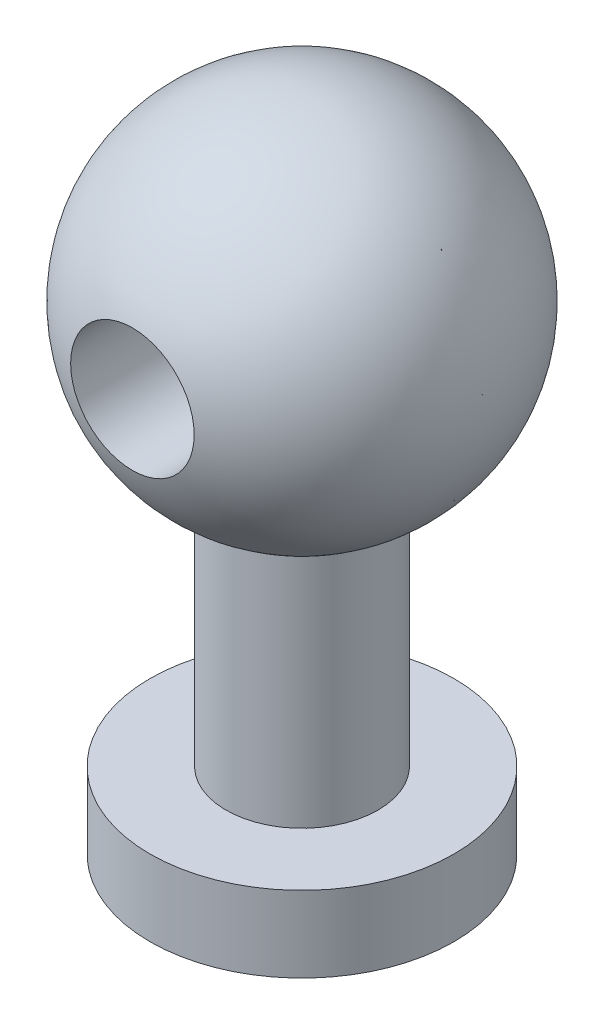
from build123d import *

# Parameters (mm, degrees)
REVOLVE1_ANGLE     = 359.999695921
SKETCH2_R          = 3.25
CUT_EXTRUDE1_DEPTH = 20


with BuildPart() as part:
    # Sketch1 → Revolve1 (revolve)
    with BuildSketch(Plane.XY):
        with BuildLine():
            Line((0, 0), (8, 0))
            Line((8, 0), (8, 4))
            Line((8, 4), (4, 4))
            Line((4, 4), (4, 16.58315603))
            ThreePointArc((4, 16.58315603), (9.2765839, 27.248167753), (0, 34.7))
            Line((0, 34.7), (0, 0))
        make_face()
    revolve(axis=Axis((0, 0, 0), (0, 1, 0)), revolution_arc=REVOLVE1_ANGLE)

    # Sketch2 → Cut-Extrude1 (cut, symmetric)
    with BuildSketch(Plane.XY):
        with Locations((0, 25.2)):
            Circle(SKETCH2_R)
    extrude(amount=CUT_EXTRUDE1_DEPTH, both=True, mode=Mode.SUBTRACT)


solid = part.part
